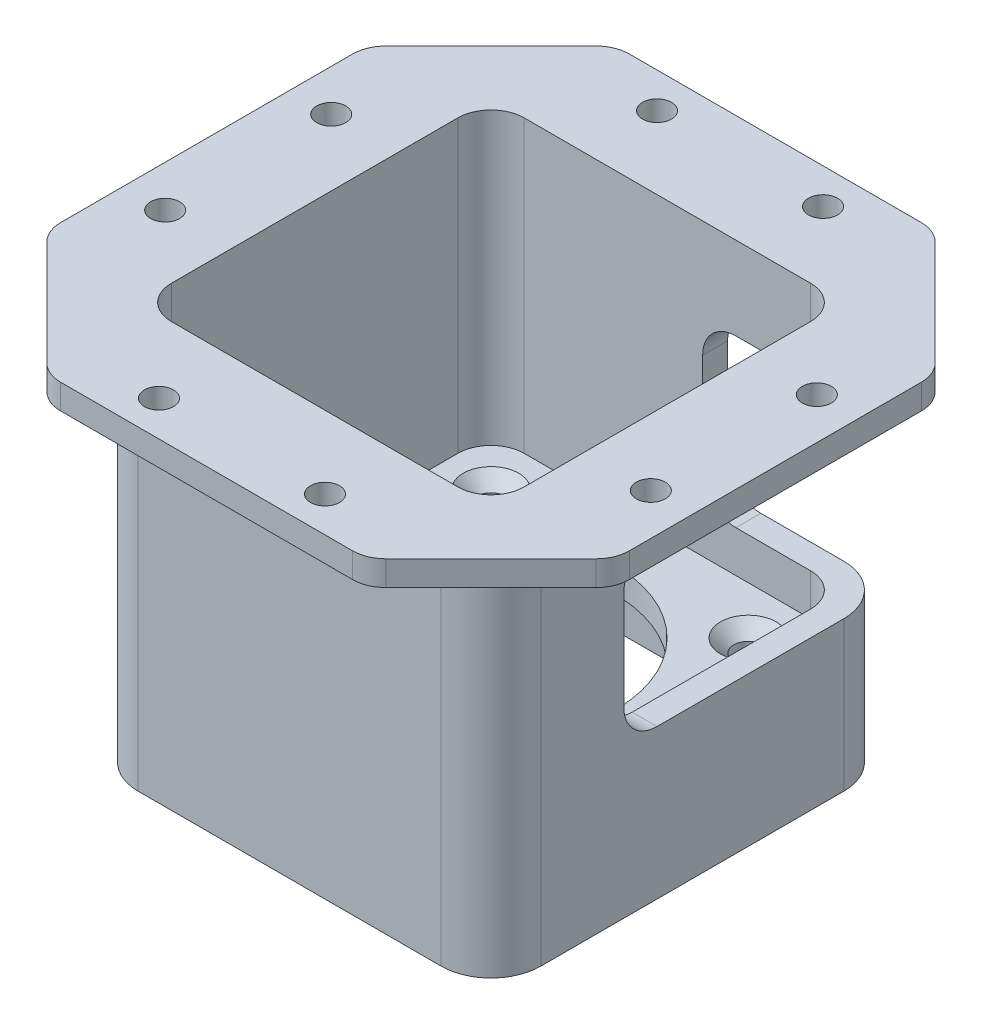
from build123d import *

# Parameters (mm, degrees)
SKETCH2_W           = 48.5
SKETCH2_H           = 48.5
SKETCH2_R           = 15
SKETCH2_R_2         = 1.75
BOSS_EXTRUDE1_DEPTH = 3
SKETCH3_W           = 48.5
SKETCH3_H           = 48.5
SKETCH3_W_2         = 42.5
SKETCH3_H_2         = 42.5
BOSS_EXTRUDE2_DEPTH = 32
SKETCH4_W           = 68.5
SKETCH4_H           = 68.5
SKETCH4_R           = 1.75
SKETCH4_W_2         = 42.5
SKETCH4_H_2         = 42.5
BOSS_EXTRUDE3_DEPTH = 3
CHAMFER1_SIZE       = 15
SKETCH5_W           = 48.5
SKETCH5_H           = 48.5
SKETCH5_W_2         = 42.5
SKETCH5_H_2         = 42.5
BOSS_EXTRUDE4_DEPTH = 10
FILLET1_R           = 6
SKETCH7_W           = 45
SKETCH7_H           = 20
CUT_EXTRUDE2_DEPTH  = 20
FILLET2_R           = 4
CHAMFER2_SIZE       = 1.6
FILLET4_R           = 4
FILLET5_R           = 4
FILLET6_R           = 3


with BuildPart() as part:
    # Sketch2 → Boss-Extrude1 (new body)
    with BuildSketch(Plane(origin=(0, 0, 0), x_dir=(1, 0, 0), z_dir=(0, 1, 0))):
        Rectangle(SKETCH2_W, SKETCH2_H)
        Circle(SKETCH2_R, mode=Mode.SUBTRACT)
        with Locations((-15.5, 15.5)):
            Circle(SKETCH2_R_2, mode=Mode.SUBTRACT)
        with Locations((15.5, 15.5)):
            Circle(SKETCH2_R_2, mode=Mode.SUBTRACT)
        with Locations((15.5, -15.5)):
            Circle(SKETCH2_R_2, mode=Mode.SUBTRACT)
        with Locations((-15.5, -15.5)):
            Circle(SKETCH2_R_2, mode=Mode.SUBTRACT)
    extrude(amount=BOSS_EXTRUDE1_DEPTH)

    # Sketch3 → Boss-Extrude2 (add)
    with BuildSketch(Plane(origin=(0, 3, 0), x_dir=(1, 0, 0), z_dir=(0, 1, 0))):
        Rectangle(SKETCH3_W, SKETCH3_H)
        Rectangle(SKETCH3_W_2, SKETCH3_H_2, mode=Mode.SUBTRACT)
    extrude(amount=BOSS_EXTRUDE2_DEPTH)

    # Sketch4 → Boss-Extrude3 (add)
    with BuildSketch(Plane(origin=(0, 35, 0), x_dir=(1, 0, 0), z_dir=(0, 1, 0))):
        Rectangle(SKETCH4_W, SKETCH4_H)
        with Locations((-10, 30)):
            Circle(SKETCH4_R, mode=Mode.SUBTRACT)
        with Locations((10, 30)):
            Circle(SKETCH4_R, mode=Mode.SUBTRACT)
        with Locations((-29.25, 10)):
            Circle(SKETCH4_R, mode=Mode.SUBTRACT)
        with Locations((-29.25, -10)):
            Circle(SKETCH4_R, mode=Mode.SUBTRACT)
        with Locations((-10, -30)):
            Circle(SKETCH4_R, mode=Mode.SUBTRACT)
        with Locations((10, -30)):
            Circle(SKETCH4_R, mode=Mode.SUBTRACT)
        with Locations((29.25, -10)):
            Circle(SKETCH4_R, mode=Mode.SUBTRACT)
        with Locations((29.25, 10)):
            Circle(SKETCH4_R, mode=Mode.SUBTRACT)
        Rectangle(SKETCH4_W_2, SKETCH4_H_2, mode=Mode.SUBTRACT)
    extrude(amount=BOSS_EXTRUDE3_DEPTH)

    # Chamfer1
    chamfer1_edges = [part.edges().sort_by_distance(p)[0] for p in [
        (34.25, 36.5, 34.25),
        (34.25, 36.5, -34.25),
        (-34.25, 36.5, -34.25),
        (-34.25, 36.5, 34.25),
    ]]
    chamfer(chamfer1_edges, length=CHAMFER1_SIZE)

    # Sketch5 → Boss-Extrude4 (add)
    with BuildSketch(Plane.XZ):
        Rectangle(SKETCH5_W, SKETCH5_H)
        Rectangle(SKETCH5_W_2, SKETCH5_H_2, mode=Mode.SUBTRACT)
    extrude(amount=BOSS_EXTRUDE4_DEPTH)

    # Fillet1
    fillet1_edges = [part.edges().sort_by_distance(p)[0] for p in [
        (-24.25, 12.5, 24.25),
        (-24.25, 12.5, -24.25),
        (24.25, 12.5, 24.25),
        (24.25, 12.5, -24.25),
    ]]
    fillet(fillet1_edges, radius=FILLET1_R)

    # Sketch7 → Cut-Extrude2 (cut)
    with BuildSketch(Plane(origin=(24.25, 0, 0), x_dir=(0, 0, -1), z_dir=(1, 0, 0))):
        with Locations((14.25, 18)):
            Rectangle(SKETCH7_W, SKETCH7_H)
    extrude(amount=-CUT_EXTRUDE2_DEPTH, mode=Mode.SUBTRACT)

    # Fillet2
    fillet2_edges = [part.edges().sort_by_distance(p)[0] for p in [
        (-19.25, 36.5, 34.25),
        (-34.25, 36.5, 19.25),
        (-34.25, 36.5, -19.25),
        (-19.25, 36.5, -34.25),
        (19.25, 36.5, -34.25),
        (34.25, 36.5, -19.25),
        (19.25, 36.5, 34.25),
        (34.25, 36.5, 19.25),
    ]]
    fillet(fillet2_edges, radius=FILLET2_R)

    # Chamfer2
    chamfer2_edges = [part.edges().sort_by_distance(p)[0] for p in [
        (-17.25, 3, 15.5),
        (-17.25, 3, -15.5),
        (13.75, 3, 15.5),
        (13.75, 3, -15.5),
    ]]
    chamfer(chamfer2_edges, length=CHAMFER2_SIZE)

    # Fillet4
    fillet4_edges = [part.edges().sort_by_distance(p)[0] for p in [
        (-21.25, 20.5, -21.25),
        (-21.25, 20.5, 21.25),
        (21.25, 20.5, 21.25),
        (21.25, 5.5, -21.25),
        (21.25, 33, -21.25),
    ]]
    fillet(fillet4_edges, radius=FILLET4_R)

    # Fillet5
    fillet5_edges = [part.edges().sort_by_distance(p)[0] for p in [
        (22.75, 28, 8.25),
        (22.75, 8, 8.25),
        (4.25, 28, -22.75),
        (4.25, 8, -22.75),
    ]]
    fillet(fillet5_edges, radius=FILLET5_R)

    # Fillet6
    fillet6_edges = [part.edges().sort_by_distance(p)[0] for p in [
        (-21.25, -5, -21.25),
        (-21.25, -5, 21.25),
        (21.25, -5, -21.25),
        (21.25, -5, 21.25),
    ]]
    fillet(fillet6_edges, radius=FILLET6_R)


solid = part.part
